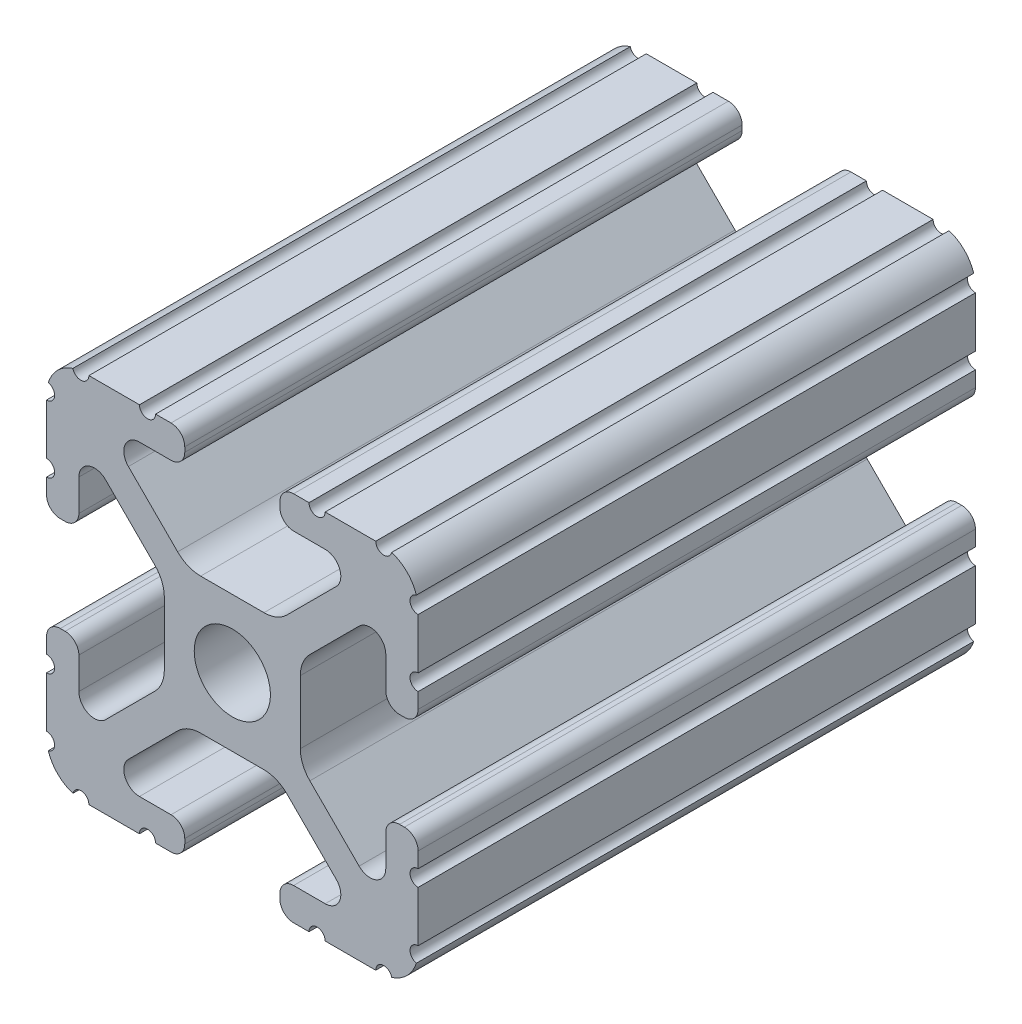
from build123d import *

# Parameters (mm, degrees)
BOSS_EXTRUDE1_DEPTH     = 76.2
CUT_EXTRUDE1_DEPTH      = 79.288057838
CUT_EXTRUDE1_DEPTH_BACK = 79.288057838
SKETCH5_R               = 0.55245
SKETCH6_W               = 25.4
SKETCH6_H               = 25.4
CUT_EXTRUDE2_DEPTH      = 79.288057838
SKETCH7_W               = 25.4
SKETCH7_H               = 25.4
CUT_EXTRUDE3_DEPTH      = 43.121134838
SKETCH9_R               = 3.2639
CUT_EXTRUDE4_DEPTH      = 82.319677815


with BuildPart() as part:
    # Sketch4 → Boss-Extrude1 (new, symmetric)
    with BuildSketch(Plane.XY):
        with BuildLine():
            Line((4.190365, -12.7), (10.11729625, -12.7))
            ThreePointArc((10.11729625, -12.7), (11.943543585, -11.943543585), (12.7, -10.11729625))
            Line((12.7, -10.11729625), (12.7, -4.190365))
            ThreePointArc((12.7, -4.190365), (12.42492494, -3.52627506), (11.760835, -3.2512))
            Line((11.760835, -3.2512), (11.429365, -3.2512))
            ThreePointArc((11.429365, -3.2512), (10.76527506, -3.52627506), (10.4902, -4.190365))
            Line((10.4902, -4.190365), (10.4902, -6.348478019))
            ThreePointArc((10.4902, -6.348478019), (9.830707141, -7.335478831), (8.666460301, -7.103895736))
            Line((8.666460301, -7.103895736), (5.299899128, -3.737334563))
            ThreePointArc((5.299899128, -3.737334563), (4.817571085, -3.015479634), (4.6482, -2.16399369))
            Line((4.6482, -2.16399369), (4.6482, 0))
            Line((4.6482, 0), (2.6035, 0))
            ThreePointArc((2.6035, 0), (1.840952505, -1.840952505), (0, -2.6035))
            Line((0, -2.6035), (0, -4.6482))
            Line((0, -4.6482), (2.16399369, -4.6482))
            ThreePointArc((2.16399369, -4.6482), (3.015479634, -4.817571085), (3.737334563, -5.299899128))
            Line((3.737334563, -5.299899128), (7.103895736, -8.666460301))
            ThreePointArc((7.103895736, -8.666460301), (7.335478831, -9.830707141), (6.348478019, -10.4902))
            Line((6.348478019, -10.4902), (4.190365, -10.4902))
            ThreePointArc((4.190365, -10.4902), (3.52627506, -10.76527506), (3.2512, -11.429365))
            Line((3.2512, -11.429365), (3.2512, -11.760835))
            ThreePointArc((3.2512, -11.760835), (3.52627506, -12.42492494), (4.190365, -12.7))
        make_face()
    extrude(amount=BOSS_EXTRUDE1_DEPTH, both=True)

    # Sketch5 → Cut-Extrude1 (cut, two sides: drawn at the far end of the back side and taken through both)
    with BuildSketch(Plane.XY.offset(-CUT_EXTRUDE1_DEPTH_BACK)):
        with Locations((10.356153152, -12.7)):
            Circle(SKETCH5_R)
        with Locations((5.796028019, -12.7)):
            Circle(SKETCH5_R)
        with Locations((12.7, -10.356153152)):
            Circle(SKETCH5_R)
        with Locations((12.7, -5.796028019)):
            Circle(SKETCH5_R)
    extrude(amount=CUT_EXTRUDE1_DEPTH + CUT_EXTRUDE1_DEPTH_BACK, mode=Mode.SUBTRACT)

    # Mirror1: part across plane


with BuildPart() as part_1:
    add(part.part)
    add(part.part.mirror(Plane(origin=(0, 0, 0), x_dir=(0, 0, 1), z_dir=(1, 0, 0))))

    # Mirror2: part across plane


with BuildPart() as part_2:
    add(part_1.part)
    add(part_1.part.mirror(Plane.ZX))

    # Sketch6 → Cut-Extrude2 (cut, through all)
    with BuildSketch(Plane(origin=(0, 0, 0), x_dir=(-1, 0, 0), z_dir=(0, 0, -1))):
        Rectangle(SKETCH6_W, SKETCH6_H)
    extrude(amount=-CUT_EXTRUDE2_DEPTH, mode=Mode.SUBTRACT)

    # Sketch7 → Cut-Extrude3 (cut, through all)
    with BuildSketch(Plane(origin=(0, 0, -38.1), x_dir=(-1, 0, 0), z_dir=(0, 0, -1))):
        Rectangle(SKETCH7_W, SKETCH7_H)
    extrude(amount=-CUT_EXTRUDE3_DEPTH, mode=Mode.SUBTRACT)

    # Sketch9 → Cut-Extrude4 (cut, through all)
    with BuildSketch(Plane.ZY.offset(12.7)):
        with Locations((-50.8, 0.060001566)):
            Circle(SKETCH9_R)
    extrude(amount=-CUT_EXTRUDE4_DEPTH, mode=Mode.SUBTRACT)


solid = part_2.part
